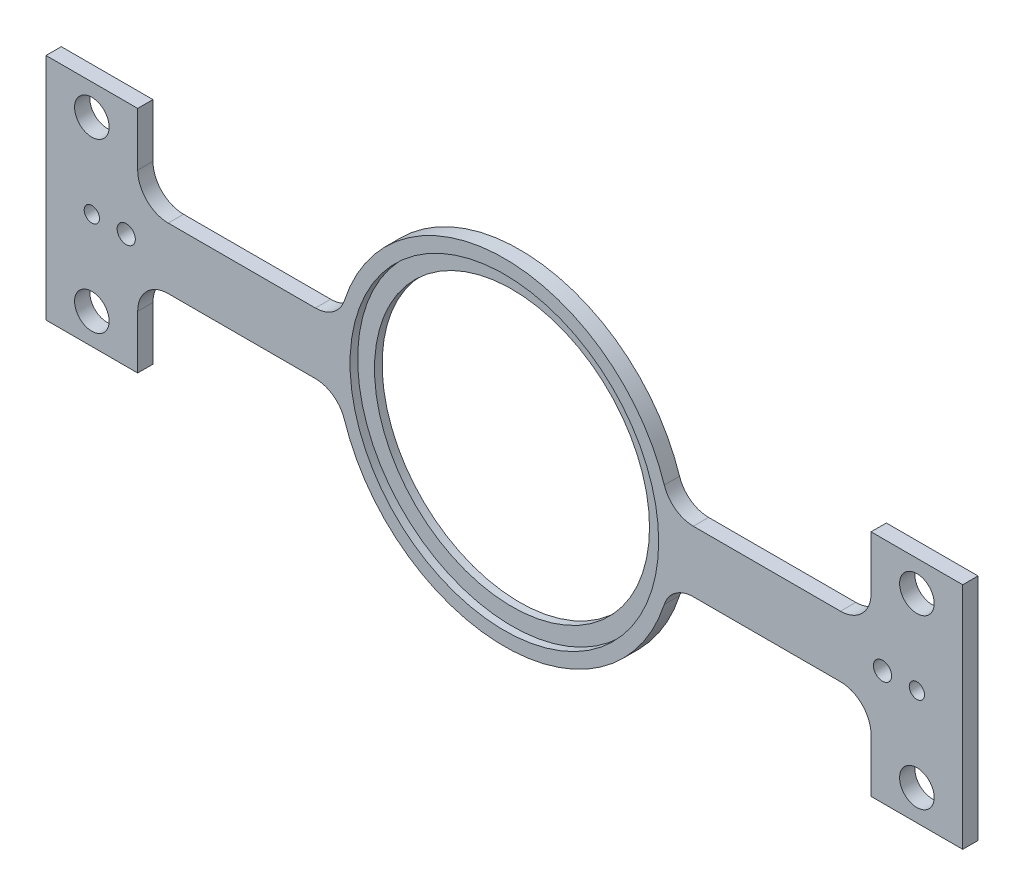
from build123d import *

# Parameters (mm, degrees)
SKETCH1_R             = 9
BOSS_EXTRUDE1_DEPTH   = 1
SKETCH2_R             = 10.1
CUT_EXTRUDE1_DEPTH    = 0.5
SKETCH6_R             = 0.5
CUT_EXTRUDE3_DEPTH    = 32.968734726
F_1_CLEARANCE_HOLE1_D = 2.2606
F_0_80_TAPPED_HOLE1_D = 1.19126
FILLET1_R             = 2


with BuildPart() as part:
    # Sketch1 → Boss-Extrude1 (new body)
    with BuildSketch(Plane.XY):
        with BuildLine():
            Line((10.816653826, 2), (24, 2))
            Line((24, 2), (24, 7.5))
            Line((24, 7.5), (30, 7.5))
            Line((30, 7.5), (30, -7.5))
            Line((30, -7.5), (24, -7.5))
            Line((24, -7.5), (24, -2))
            Line((24, -2), (10.816653826, -2))
            ThreePointArc((10.816653826, -2), (0, -11), (-10.816653826, -2))
            Line((-10.816653826, -2), (-24, -2))
            Line((-24, -2), (-24, -7.5))
            Line((-24, -7.5), (-30, -7.5))
            Line((-30, -7.5), (-30, 7.5))
            Line((-30, 7.5), (-24, 7.5))
            Line((-24, 7.5), (-24, 2))
            Line((-24, 2), (-10.816653826, 2))
            ThreePointArc((-10.816653826, 2), (0, 11), (10.816653826, 2))
        make_face()
        Circle(SKETCH1_R, mode=Mode.SUBTRACT)
    extrude(amount=BOSS_EXTRUDE1_DEPTH)

    # Sketch2 → Cut-Extrude1 (cut)
    with BuildSketch(Plane.XY.offset(1)):
        Circle(SKETCH2_R)
    extrude(amount=-CUT_EXTRUDE1_DEPTH, mode=Mode.SUBTRACT)

    # Sketch6 → Cut-Extrude3 (cut, through all)
    with BuildSketch(Plane(origin=(0, 0, 0), x_dir=(-1, 0, 0), z_dir=(0, 0, -1))):
        with Locations((-27, 0)):
            Circle(SKETCH6_R)
        with Locations((27, 0)):
            Circle(SKETCH6_R)
    extrude(amount=-CUT_EXTRUDE3_DEPTH, mode=Mode.SUBTRACT)

    # #1 Clearance Hole1 (through all)
    with Locations(Plane(origin=(0, 0, 0), x_dir=(-1, 0, 0), z_dir=(0, 0, -1))):
        with Locations((-27, -5.5), (-27, 5.5), (27, 5.5), (27, -5.5)):
            Hole(F_1_CLEARANCE_HOLE1_D / 2)

    # #0-80 Tapped Hole1 (through all)
    with Locations(Plane(origin=(0, 0, 0), x_dir=(-1, 0, 0), z_dir=(0, 0, -1))):
        with Locations((-24.75, 0), (24.75, 0)):
            Hole(F_0_80_TAPPED_HOLE1_D / 2)

    # Fillet1
    fillet1_edges = [part.edges().sort_by_distance(p)[0] for p in [
        (-24, -2, 0.5),
        (-10.816653826, -2, 0.5),
        (10.816653826, -2, 0.5),
        (24, -2, 0.5),
        (-10.816653826, 2, 0.5),
        (24, 2, 0.5),
        (10.816653826, 2, 0.5),
        (-24, 2, 0.5),
    ]]
    fillet(fillet1_edges, radius=FILLET1_R)


solid = part.part
